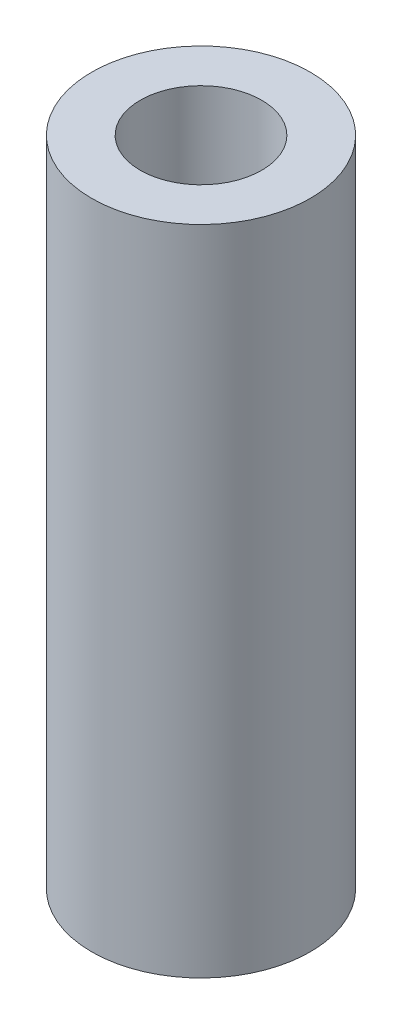
from build123d import *

# Parameters (mm, degrees)
SZKIC1_W = 28
SZKIC1_H = 376


with BuildPart() as part:
    # Szkic1 → Obrót1 (revolve)
    with BuildSketch(Plane.XY):
        with Locations((49, 0)):
            Rectangle(SZKIC1_W, SZKIC1_H)
    revolve(axis=Axis((0, 344.744344029, 0), (0, -1, 0)))


solid = part.part
